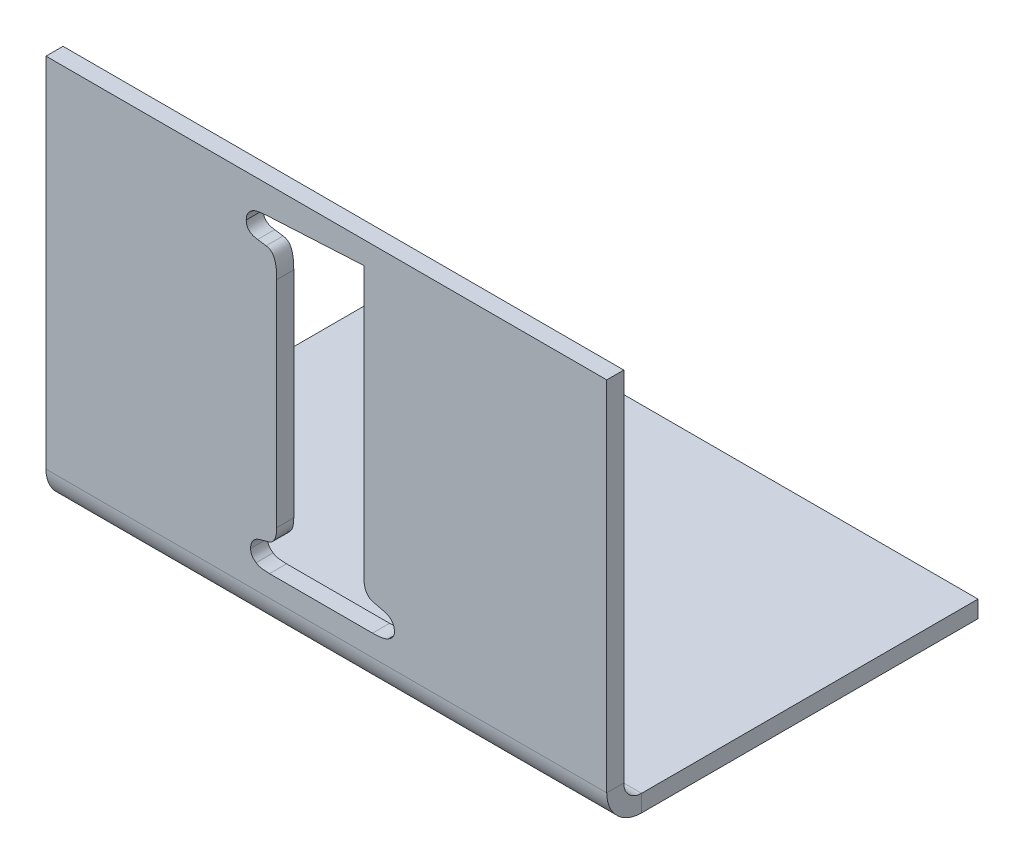
from build123d import *

# Parameters (mm, degrees)
SKETCH1_W            = 50
SKETCH1_H            = 30
BASE_FLANGE1_DEPTH   = 1.51892
EDGE_FLANGE1_DEPTH   = 50
M8_CLEARANCE_HOLE1_D = 9
CUT_EXTRUDE1_DEPTH   = 55.277389816


# Sheet-metal steps are written as plain solids
with BuildPart() as part:
    # Sketch1 → Base-Flange1 (new body)
    with BuildSketch(Plane(origin=(0, 0, 0), x_dir=(1, 0, 0), z_dir=(0, 1, 0))):
        with Locations((0, 15)):
            Rectangle(SKETCH1_W, SKETCH1_H)
    extrude(amount=BASE_FLANGE1_DEPTH)

    # Edge-Flange1 section (across the edge) → Edge-Flange1 (add)
    with BuildSketch(Plane(origin=(-25, 1.51892, 1.5875), x_dir=(0, 0, -1), z_dir=(1, 0, 0))):
        with BuildLine():
            Line((-1.51892, 1.5875), (-1.51892, 33.48108))
            Line((-1.51892, 33.48108), (0, 33.48108))
            Line((0, 33.48108), (0, 1.5875))
            ThreePointArc((0, 1.5875), (0.464967985, 0.464967985), (1.5875, 0))
            Line((1.5875, 0), (1.5875, -1.51892))
            ThreePointArc((1.5875, -1.51892), (-0.609070647, -0.609070647), (-1.51892, 1.5875))
        make_face()
    extrude(amount=EDGE_FLANGE1_DEPTH)

    # M8 Clearance Hole1 (through all)
    with Locations(Plane(origin=(0, 1.51892, 0), x_dir=(1, 0, 0), z_dir=(0, 1, 0))):
        with Locations((-13, 21.89358)):
            Hole(M8_CLEARANCE_HOLE1_D / 2)

    # Sketch11 → Cut-Extrude1 (cut, through all)
    with BuildSketch(Plane.XY.offset(3.10642)):
        with BuildLine():
            Line((3.352683653, 33), (3.352683653, 8.876736111))
            add(Edge.make_bspline(
                [(3.352683653, 8.876736111), (3.353743072, 8.75248746), (3.355707508, 8.522098259), (3.431182496, 8.208449128), (3.514980812, 7.935424237), (3.62773347, 7.798723212), (3.680808653, 7.734375)],
                knots=[0, 0, 0, 0, 1.221894812, 2.265709648, 3.183630964, 4, 4, 4, 4], degree=3))
            add(Edge.make_bspline(
                [(3.680808653, 7.734375), (3.734677776, 7.676504164), (3.830117167, 7.573974975), (3.989367782, 7.479439012), (4.159797664, 7.433882679), (4.373058128, 7.390651398), (4.667575389, 7.304305676), (4.895720619, 7.252831146), (5.023690598, 7.223958333)],
                knots=[0, 0, 0, 0, 0.967781164, 1.714608312, 2.234126727, 3.127399629, 4.388716669, 6, 6, 6, 6], degree=3))
            add(Edge.make_bspline(
                [(5.023690598, 7.223958333), (5.181883466, 7.183631094), (5.472950316, 7.109431018), (5.825003123, 6.855284919), (6.042399674, 6.503977916), (6.06374242, 6.238622284), (6.074905875, 6.099826389)],
                knots=[0, 0, 0, 0, 1.155259645, 2.125619132, 3.019593567, 4, 4, 4, 4], degree=3))
            add(Edge.make_bspline(
                [(6.074905875, 6.099826389), (6.06732471, 6.015842007), (6.052127137, 5.847482842), (5.944064224, 5.60615586), (5.75097894, 5.402699673), (5.589337522, 5.298332742), (5.50372532, 5.243055556)],
                knots=[0, 0, 0, 0, 0.931770353, 1.867872026, 2.870733925, 4, 4, 4, 4], degree=3))
            add(Edge.make_bspline(
                [(5.50372532, 5.243055556), (5.423622762, 5.206171118), (5.246520526, 5.124621709), (4.930300382, 5.048945746), (4.546600649, 5.012201245), (4.268276747, 5.004272313), (4.118308653, 5)],
                knots=[0, 0, 0, 0, 0.744408225, 1.645844579, 2.731520362, 4, 4, 4, 4], degree=3))
            Line((4.118308653, 5), (3.37091282, 5))
            Line((3.37091282, 5), (-4.443323291, 5))
            Line((-4.443323291, 5), (-5.069191347, 5))
            add(Edge.make_bspline(
                [(-5.069191347, 5), (-5.200959456, 5.004230902), (-5.445003537, 5.012066838), (-5.780351524, 5.049107042), (-6.053589539, 5.123405658), (-6.200525, 5.206080373), (-6.266239958, 5.243055556)],
                knots=[0, 0, 0, 0, 1.278909849, 2.36863365, 3.270392795, 4, 4, 4, 4], degree=3))
            add(Edge.make_bspline(
                [(-6.266239958, 5.243055556), (-6.339681587, 5.298913512), (-6.481004414, 5.406400292), (-6.646771526, 5.611036077), (-6.740904198, 5.849325914), (-6.752565064, 6.016021642), (-6.758427458, 6.099826389)],
                knots=[0, 0, 0, 0, 1.071870055, 2.062586414, 3.025983099, 4, 4, 4, 4], degree=3))
            add(Edge.make_bspline(
                [(-6.758427458, 6.099826389), (-6.751201394, 6.238381888), (-6.737517447, 6.500763459), (-6.542576602, 6.842832855), (-6.244911058, 7.108230032), (-5.985928279, 7.183546642), (-5.846969125, 7.223958333)],
                knots=[0, 0, 0, 0, 1.041821617, 1.972890251, 2.912339053, 4, 4, 4, 4], degree=3))
            add(Edge.make_bspline(
                [(-5.846969125, 7.223958333), (-5.735122036, 7.252770415), (-5.537017037, 7.303802744), (-5.285346725, 7.389215809), (-5.104551332, 7.434528827), (-4.959644822, 7.480235759), (-4.824408418, 7.574602156), (-4.751821285, 7.676581079), (-4.710684402, 7.734375)],
                knots=[0, 0, 0, 0, 1.624637859, 2.877579422, 3.734891967, 4.248647568, 5.007466236, 6, 6, 6, 6], degree=3))
            add(Edge.make_bspline(
                [(-4.710684402, 7.734375), (-4.664199883, 7.799255117), (-4.563973926, 7.939144093), (-4.49111496, 8.20905769), (-4.431859524, 8.523582896), (-4.42746965, 8.752733909), (-4.425094125, 8.876736111)],
                knots=[0, 0, 0, 0, 0.793417505, 1.710699182, 2.761173524, 4, 4, 4, 4], degree=3))
            Line((-4.425094125, 8.876736111), (-4.425094125, 28.0234375))
            add(Edge.make_bspline(
                [(-4.425094125, 28.0234375), (-4.426531902, 28.191669086), (-4.429205189, 28.504465382), (-4.470592994, 28.937557572), (-4.538640115, 29.30004587), (-4.643358024, 29.592207067), (-4.770170391, 29.828354389), (-4.936878879, 30.004608948), (-5.143251784, 30.120886097), (-5.294711667, 30.152209661), (-5.373010791, 30.168402778)],
                knots=[0, 0, 0, 0, 1.573891919, 2.926368201, 4.067733782, 5.015207088, 5.82171764, 6.559095732, 7.255106106, 8, 8, 8, 8], degree=3))
            Line((-5.373010791, 30.168402778), (-6.132559402, 30.271701389))
            add(Edge.make_bspline(
                [(-6.132559402, 30.271701389), (-6.283854904, 30.300098434), (-6.559763459, 30.351884427), (-6.904178309, 30.569151507), (-7.122046768, 30.892299153), (-7.138654843, 31.143367481), (-7.147316347, 31.274305556)],
                knots=[0, 0, 0, 0, 1.161059911, 2.117355492, 3.018156337, 4, 4, 4, 4], degree=3))
            add(Edge.make_bspline(
                [(-7.147316347, 31.274305556), (-7.142422565, 31.381346659), (-7.132924891, 31.589088155), (-6.995811409, 31.871248407), (-6.805451884, 32.128706889), (-6.623451964, 32.249631783), (-6.52752468, 32.313368056)],
                knots=[0, 0, 0, 0, 1.003758752, 1.948058634, 2.918476655, 4, 4, 4, 4], degree=3))
            add(Edge.make_bspline(
                [(-6.52752468, 32.313368056), (-6.463477626, 32.342119574), (-6.312140707, 32.410056597), (-6.025881505, 32.457814765), (-5.664653043, 32.51745606), (-5.393638242, 32.534790019), (-5.245406625, 32.544270833)],
                knots=[0, 0, 0, 0, 0.641016437, 1.514659076, 2.640642126, 4, 4, 4, 4], degree=3))
            Line((-5.245406625, 32.544270833), (3.352683653, 33))
        make_face()
    extrude(amount=-CUT_EXTRUDE1_DEPTH, mode=Mode.SUBTRACT)


solid = part.part
